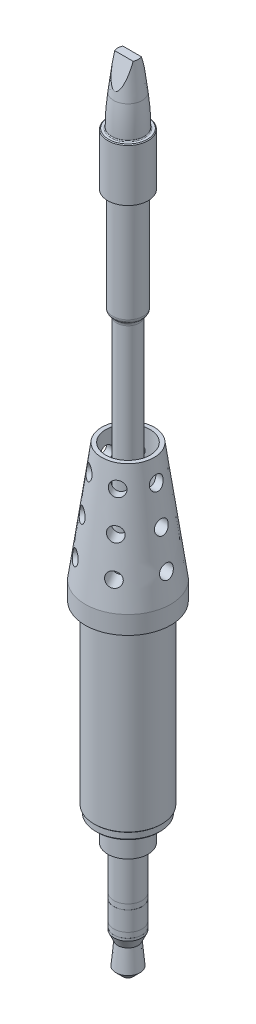
from build123d import *

# Parameters (mm, degrees)
SKETCH1_R               = 4.2
BOSS_EXTRUDE1_DEPTH     = 22
SKETCH9_R               = 3.4
BOSS_EXTRUDE8_DEPTH     = 0.7
SKETCH10_R              = 3.75
BOSS_EXTRUDE9_DEPTH     = 2.8
SKETCH11_R              = 1.8
BOSS_EXTRUDE10_DEPTH    = 2.9
SKETCH12_R              = 1.4
BOSS_EXTRUDE11_DEPTH    = 24.25
SKETCH13_R              = 1.9
BOSS_EXTRUDE12_DEPTH    = 13.2
SKETCH14_R              = 2.5
BOSS_EXTRUDE13_DEPTH    = 6.9
CUT_EXTRUDE1_DEPTH      = 81.968157321
CUT_EXTRUDE1_DEPTH_BACK = 81.968157321
FILLET1_R               = 30
CHAMFER1_SIZE           = 0.1
CHAMFER2_SIZE           = 0.4
CHAMFER3_SIZE2          = 0.6
CHAMFER3_SIZE           = 0.346410162
FILLET3_R               = 0.1
CHAMFER4_SIZE           = 0.6
FILLET4_R               = 0.6
SKETCH2_R               = 4
BOSS_EXTRUDE2_DEPTH     = 1
BOSS_EXTRUDE3_START     = 3
SKETCH3_R               = 2.5
BOSS_EXTRUDE3_DEPTH     = 3
SKETCH4_R               = 1.75
BOSS_EXTRUDE4_DEPTH     = 5.35
SKETCH5_R               = 1.74
BOSS_EXTRUDE5_DEPTH     = 0.65
SKETCH6_R               = 1.75
BOSS_EXTRUDE6_DEPTH     = 2.4
SKETCH7_R               = 1.74
BOSS_EXTRUDE7_DEPTH     = 0.65
CHAMFER5_SIZE           = 0.2
SKETCH17_R              = 5.3
BOSS_EXTRUDE14_DEPTH    = 2.25
SKETCH19_R              = 2.75
CUT_EXTRUDE2_DEPTH      = 58.589842854
SKETCH20_R              = 3.8
CUT_EXTRUDE4_DEPTH      = 3.8
SKETCH21_R              = 0.85
CUT_EXTRUDE6_DEPTH      = 82.097117804
CIRPATTERN1_COUNT       = 3


with BuildPart() as part:
    # Sketch1 → Boss-Extrude1 (new body)
    with BuildSketch(Plane(origin=(0, 0, 0), x_dir=(1, 0, 0), z_dir=(0, 1, 0))):
        with Locations(Location((0, 0, 0), (0, 0, 270))):
            Circle(SKETCH1_R)
    extrude(amount=BOSS_EXTRUDE1_DEPTH)

    # Sketch9 → Boss-Extrude8 (add)
    with BuildSketch(Plane(origin=(0, 22, 0), x_dir=(1, 0, 0), z_dir=(0, 1, 0))):
        with Locations(Location((0, 0, 0), (0, 0, 270))):
            Circle(SKETCH9_R)
    extrude(amount=BOSS_EXTRUDE8_DEPTH)

    # Sketch10 → Boss-Extrude9 (add)
    with BuildSketch(Plane(origin=(0, 22.7, 0), x_dir=(1, 0, 0), z_dir=(0, 1, 0))):
        with Locations(Location((0, 0, 0), (0, 0, 270))):
            Circle(SKETCH10_R)
    extrude(amount=BOSS_EXTRUDE9_DEPTH)

    # Sketch11 → Boss-Extrude10 (add)
    with BuildSketch(Plane(origin=(0, 25.5, 0), x_dir=(1, 0, 0), z_dir=(0, 1, 0))):
        with Locations(Location((0, 0, 0), (0, 0, 270))):
            Circle(SKETCH11_R)
    extrude(amount=BOSS_EXTRUDE10_DEPTH)

    # Sketch12 → Boss-Extrude11 (add)
    with BuildSketch(Plane(origin=(0, 28.4, 0), x_dir=(1, 0, 0), z_dir=(0, 1, 0))):
        with Locations(Location((0, 0, 0), (0, 0, 90))):
            Circle(SKETCH12_R)
    extrude(amount=BOSS_EXTRUDE11_DEPTH)

    # Sketch13 → Boss-Extrude12 (add)
    with BuildSketch(Plane(origin=(0, 52.65, 0), x_dir=(1, 0, 0), z_dir=(0, 1, 0))):
        with Locations(Location((0, 0, 0), (0, 0, 270))):
            Circle(SKETCH13_R)
    extrude(amount=BOSS_EXTRUDE12_DEPTH)

    # Sketch14 → Boss-Extrude13 (add)
    with BuildSketch(Plane(origin=(0, 65.85, 0), x_dir=(1, 0, 0), z_dir=(0, 1, 0))):
        with Locations(Location((0, 0, 0), (0, 0, 90))):
            Circle(SKETCH14_R)
    extrude(amount=BOSS_EXTRUDE13_DEPTH)

    # Sketch15 → Revolve2 (revolve)
    with BuildSketch(Plane(origin=(0, 0, 0), x_dir=(0, 0, -1), z_dir=(1, 0, 0)), mode=Mode.PRIVATE) as revolve2_sk:
        Polygon((-2, 72.75), (-2, 74.75), (-1.25, 80.75), (0, 80.75), (0, 72.75), align=None)
    revolve(revolve2_sk.sketch.rotate(Axis((0, -927.276388614, 0), (0, 1, 0)), 180), axis=Axis((0, -927.276388614, 0), (0, 1, 0)))

    # Sketch16 → Cut-Extrude1 (cut, two sides: drawn at the far end of the back side and taken through both)
    with BuildSketch(Plane(origin=(0, 0, 0), x_dir=(0, 0, -1), z_dir=(1, 0, 0)).offset(-CUT_EXTRUDE1_DEPTH_BACK)):
        Polygon((-1.25, 80.75), (-0.5, 80.75), (-1.649953268, 77.550373853), align=None)
        Polygon((1.649953268, 77.550373853), (1.25, 80.75), (0.5, 80.75), align=None)
    extrude(amount=CUT_EXTRUDE1_DEPTH + CUT_EXTRUDE1_DEPTH_BACK, mode=Mode.SUBTRACT)

    # Fillet1
    fillet1_edges = [part.edges().sort_by_distance(p)[0] for p in [
        (0, 74.75, 2),
    ]]
    fillet(fillet1_edges, radius=FILLET1_R)

    # Chamfer1
    chamfer1_edges = [part.edges().sort_by_distance(p)[0] for p in [
        (0, 0, -4.2),
        (0, 72.75, 2.5),
    ]]
    chamfer(chamfer1_edges, length=CHAMFER1_SIZE)

    # Chamfer2
    # the kernel refuses this chamfer: 0.4 mm, written as the material it takes off along each edge
    with BuildSketch(Plane(origin=(0, 25.5, 0), x_dir=(0, 0, 1), z_dir=(-1, 0, 0))) as chamfer2_piece_1:
        Polygon((3.75 - CHAMFER2_SIZE, 0), (3.75, -CHAMFER2_SIZE), (3.75, 0), align=None)
    revolve(axis=Axis((0, 25.5, 0), (0, 1, 0)), mode=Mode.SUBTRACT)
    with BuildSketch(Plane(origin=(0, 22.7, 0), x_dir=(0, 0, 1), z_dir=(-1, 0, 0))) as chamfer2_piece_2_section:
        Polygon((3.75, CHAMFER2_SIZE), (3.75 - CHAMFER2_SIZE, 0), (3.75, 0), align=None)
    chamfer2_piece_2 = revolve(axis=Axis((0, 22.7, 0), (0, 1, 0)), mode=Mode.PRIVATE)
    chamfer2_piece_2 = chamfer2_piece_2 - Plane(origin=(0, 22.7, 0), x_dir=(0, 0, 1), z_dir=(0, -1, 0)) * Cylinder(3.4, 15, mode=Mode.PRIVATE)
    add(chamfer2_piece_2, mode=Mode.SUBTRACT)

    # Chamfer3
    chamfer3_edges = [part.edges().sort_by_distance(p)[0] for p in [
        (0, 65.85, 2.5),
    ]]
    chamfer3_side = [part.faces().sort_by_distance(p)[0] for p in [
        (0, 65.856928203, 2.5),
    ]]
    chamfer(chamfer3_edges, length=CHAMFER3_SIZE - 0.0001, length2=CHAMFER3_SIZE2 - 0.0001, reference=chamfer3_side[0])  # a hair under: the kernel refuses the full size

    # Fillet3
    fillet3_edges = [part.edges().sort_by_distance(p)[0] for p in [
        (0, 72.75, 2),
    ]]
    fillet(fillet3_edges, radius=FILLET3_R)

    # Chamfer4
    # the kernel refuses this chamfer: 0.6 mm, written as the material it takes off along each edge
    with BuildSketch(Plane(origin=(0, 52.65, 0), x_dir=(0, 0, 1), z_dir=(-1, 0, 0))) as chamfer4_piece_1_section:
        Polygon((1.9, CHAMFER4_SIZE), (1.9 - CHAMFER4_SIZE, 0), (1.9, 0), align=None)
    chamfer4_piece_1 = revolve(axis=Axis((0, 52.65, 0), (0, 1, 0)), mode=Mode.PRIVATE)
    chamfer4_piece_1 = chamfer4_piece_1 - Plane(origin=(0, 52.65, 0), x_dir=(0, 0, -1), z_dir=(0, -1, 0)) * Cylinder(1.4, 8, mode=Mode.PRIVATE)
    add(chamfer4_piece_1, mode=Mode.SUBTRACT)

    # Fillet4
    # the kernel refuses this fillet: 0.6 mm, written as the material it adds along each edge
    with BuildSketch(Plane(origin=(0, 52.75, 0), x_dir=(0, 0, -1), z_dir=(-1, 0, 0))) as fillet4_piece_1:
        with BuildLine():
            CenterArc((1.4 + FILLET4_R, FILLET4_R * 0.414213562373), FILLET4_R, 180, 45)
            Line((1.4, FILLET4_R * 0.414213562373), (1.4, 0))
            Line((1.4, 0), (1.4 + FILLET4_R * 0.292893218813, -FILLET4_R * 0.292893218813))
        make_face()
    revolve(axis=Axis((0, 52.75, 0), (0, -1, 0)), revolution_arc=180)
    with BuildSketch(Plane(origin=(0, 52.75, 0), x_dir=(0, 0, 1), z_dir=(1, 0, 0))) as fillet4_piece_2:
        with BuildLine():
            CenterArc((1.4 + FILLET4_R, FILLET4_R * 0.414213562373), FILLET4_R, 180, 45)
            Line((1.4, FILLET4_R * 0.414213562373), (1.4, 0))
            Line((1.4, 0), (1.4 + FILLET4_R * 0.292893218813, -FILLET4_R * 0.292893218813))
        make_face()
    revolve(axis=Axis((0, 52.75, 0), (0, -1, 0)), revolution_arc=180)
    # the kernel refuses this fillet: 0.6 mm, written as the material it takes off along each edge
    with BuildSketch(Plane(origin=(0, 53.25, 0), x_dir=(0, 0, 1), z_dir=(-1, 0, 0))) as fillet4_2_piece_1:
        with BuildLine():
            CenterArc((1.9 - FILLET4_R, FILLET4_R * 0.414213562373), FILLET4_R, 315, 45)
            Line((1.9 - FILLET4_R * 0.292893218813, -FILLET4_R * 0.292893218813), (1.9, 0))
            Line((1.9, 0), (1.9, FILLET4_R * 0.414213562373))
        make_face()
    revolve(axis=Axis((0, 53.25, 0), (0, 1, 0)), mode=Mode.SUBTRACT)


with BuildPart() as body_2:
    # Sketch2 → Boss-Extrude2 (new body)
    with BuildSketch(Plane.XZ):
        with Locations(Location((0, 0, 0), (0, 0, 270))):
            Circle(SKETCH2_R)
    extrude(amount=BOSS_EXTRUDE2_DEPTH)

    # Sketch3 → Boss-Extrude3 (add)
    with BuildSketch(Plane.XZ.offset(1).offset(BOSS_EXTRUDE3_START)):
        with Locations(Location((0, 0, 0), (0, 0, 270))):
            Circle(SKETCH3_R)
    extrude(amount=-BOSS_EXTRUDE3_DEPTH)

    # Sketch4 → Boss-Extrude4 (add)
    with BuildSketch(Plane.XZ.offset(4)):
        with Locations(Location((0, 0, 0), (0, 0, 270))):
            Circle(SKETCH4_R)
    extrude(amount=BOSS_EXTRUDE4_DEPTH)

    # Chamfer5
    chamfer5_edges = [body_2.edges().sort_by_distance(p)[0] for p in [
        (0, -1, 4),
    ]]
    chamfer(chamfer5_edges, length=CHAMFER5_SIZE)


with BuildPart() as body_3:
    # Sketch5 → Boss-Extrude5 (new body)
    with BuildSketch(Plane.XZ.offset(9.35)):
        with Locations(Location((0, 0, 0), (0, 0, 270))):
            Circle(SKETCH5_R)
    extrude(amount=BOSS_EXTRUDE5_DEPTH)


with BuildPart() as body_4:
    # Sketch6 → Boss-Extrude6 (new body)
    with BuildSketch(Plane.XZ.offset(10)):
        with Locations(Location((0, 0, 0), (0, 0, 270))):
            Circle(SKETCH6_R)
    extrude(amount=BOSS_EXTRUDE6_DEPTH)


with BuildPart() as body_5:
    # Sketch7 → Boss-Extrude7 (new body)
    with BuildSketch(Plane.XZ.offset(12.4)):
        with Locations(Location((0, 0, 0), (0, 0, 270))):
            Circle(SKETCH7_R)
    extrude(amount=BOSS_EXTRUDE7_DEPTH)


with BuildPart() as body_6:
    # Sketch8 → Revolve1 (revolve)
    with BuildSketch(Plane(origin=(0, 0, 0), x_dir=(0, 0, -1), z_dir=(1, 0, 0)), mode=Mode.PRIVATE) as revolve1_sk:
        Polygon((0, -13.05), (-1.75, -13.05), (-1.75, -13.35), (-1.25, -14.436183047), (-1.5, -17.225), (-0.625, -18.1), (0, -18.1), align=None)
    revolve(revolve1_sk.sketch.rotate(Axis((0, -1013.0180615, 0), (0, 1, 0)), 180), axis=Axis((0, -1013.0180615, 0), (0, 1, 0)))


with BuildPart() as body_7:
    # Sketch17 → Boss-Extrude14 (new body)
    with BuildSketch(Plane(origin=(0, 22, 0), x_dir=(1, 0, 0), z_dir=(0, 1, 0))):
        with Locations(Location((0, 0, 0), (0, 0, 270))):
            Circle(SKETCH17_R)
    extrude(amount=BOSS_EXTRUDE14_DEPTH)

    # Sketch18 → Revolve3 (revolve)
    with BuildSketch(Plane(origin=(0, 0, 0), x_dir=(0, 0, -1), z_dir=(1, 0, 0)), mode=Mode.PRIVATE) as revolve3_sk:
        Polygon((-5.3, 24.25), (-3.25, 39), (0, 39), (0, 24.25), align=None)
    revolve(revolve3_sk.sketch.rotate(Axis((0, -958.078219059, 0), (0, 1, 0)), 180), axis=Axis((0, -958.078219059, 0), (0, 1, 0)))

    # Sketch19 → Cut-Extrude2 (cut, through all)
    with BuildSketch(Plane(origin=(0, 39, 0), x_dir=(1, 0, 0), z_dir=(0, 1, 0))):
        with Locations(Location((0, 0, 0), (0, 0, 270))):
            Circle(SKETCH19_R)
    extrude(amount=-CUT_EXTRUDE2_DEPTH, mode=Mode.SUBTRACT)

    # Sketch20 → Cut-Extrude4 (cut)
    with BuildSketch(Plane.XZ.offset(-22)):
        with Locations(Location((0, 0, 0), (0, 0, 270))):
            Circle(SKETCH20_R)
    extrude(amount=-CUT_EXTRUDE4_DEPTH, mode=Mode.SUBTRACT)

    # Chamfer6: read off the stored shape, not the designer's step
    # Chamfer6 outline → Chamfer6 (revolve, cut)
    with BuildSketch(Plane.XY):
        Polygon((4.2, 22), (3.8, 22.4), (3.8, 22), align=None)
    revolve(axis=Axis((0, 0, 0), (0, 1, 0)), mode=Mode.SUBTRACT)

    # Sketch21 → Cut-Extrude6 (cut, symmetric)
    with BuildSketch(Plane(origin=(0, 0, 0), x_dir=(0, 0, -1), z_dir=(1, 0, 0))):
        with Locations((0, 36.45)):
            Circle(SKETCH21_R)
        with Locations((0, 32)):
            Circle(SKETCH21_R)
        with Locations((0, 27.55)):
            Circle(SKETCH21_R)
    cut_extrude6 = extrude(amount=CUT_EXTRUDE6_DEPTH, both=True, mode=Mode.SUBTRACT)

    # CirPattern1: Cut-Extrude6 ×3 about axis
    cirpattern1_axis = Axis((0, 39, 0), (0, -1, 0))
    for i in range(1, CIRPATTERN1_COUNT):
        add(cut_extrude6.rotate(cirpattern1_axis, i * 360 / CIRPATTERN1_COUNT), mode=Mode.SUBTRACT)


solid = Compound([part.part, body_2.part, body_3.part, body_4.part, body_5.part, body_6.part, body_7.part])
